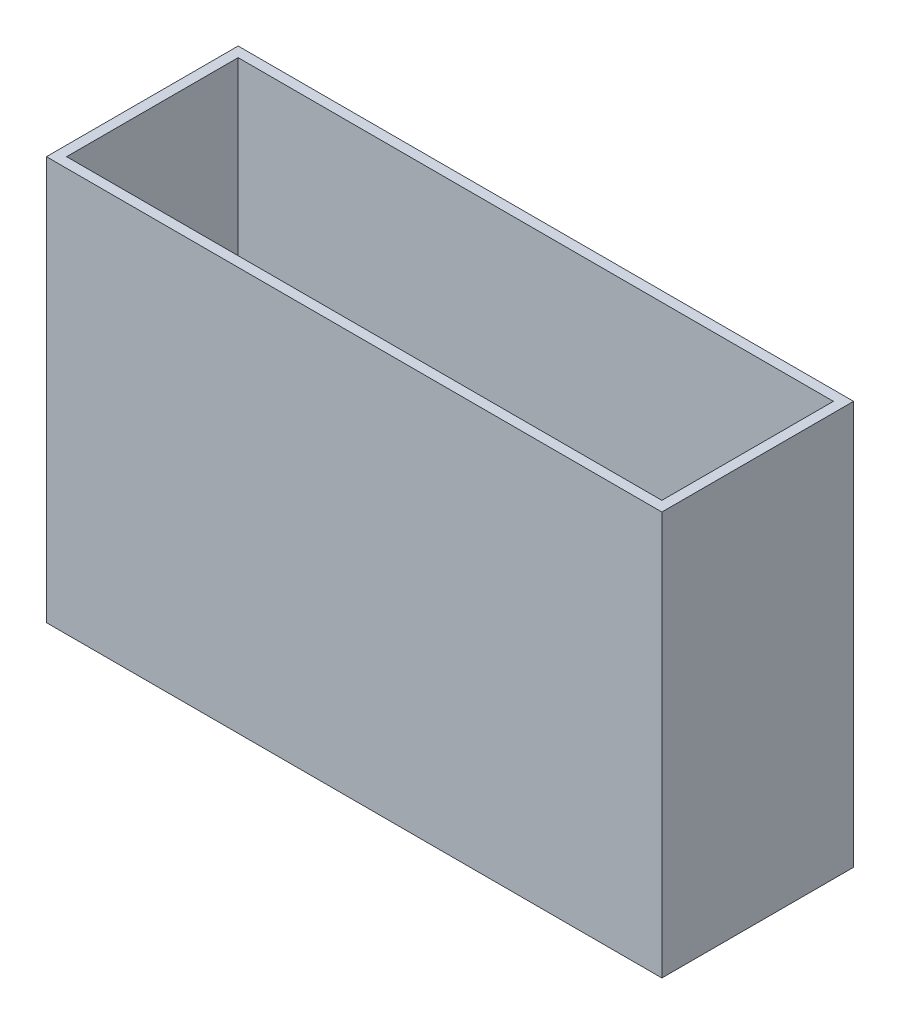
from build123d import *

# Parameters (mm, degrees)
SKETCH1_W           = 30.5
SKETCH1_H           = 9.5
SKETCH1_W_2         = 29.5
SKETCH1_H_2         = 8.5
BOSS_EXTRUDE1_DEPTH = 20


with BuildPart() as part:
    # Sketch1 → Boss-Extrude1 (new body)
    with BuildSketch(Plane(origin=(0, 0, 0), x_dir=(1, 0, 0), z_dir=(0, 1, 0))):
        Rectangle(SKETCH1_W, SKETCH1_H)
        Rectangle(SKETCH1_W_2, SKETCH1_H_2, mode=Mode.SUBTRACT)
    extrude(amount=BOSS_EXTRUDE1_DEPTH)


solid = part.part
